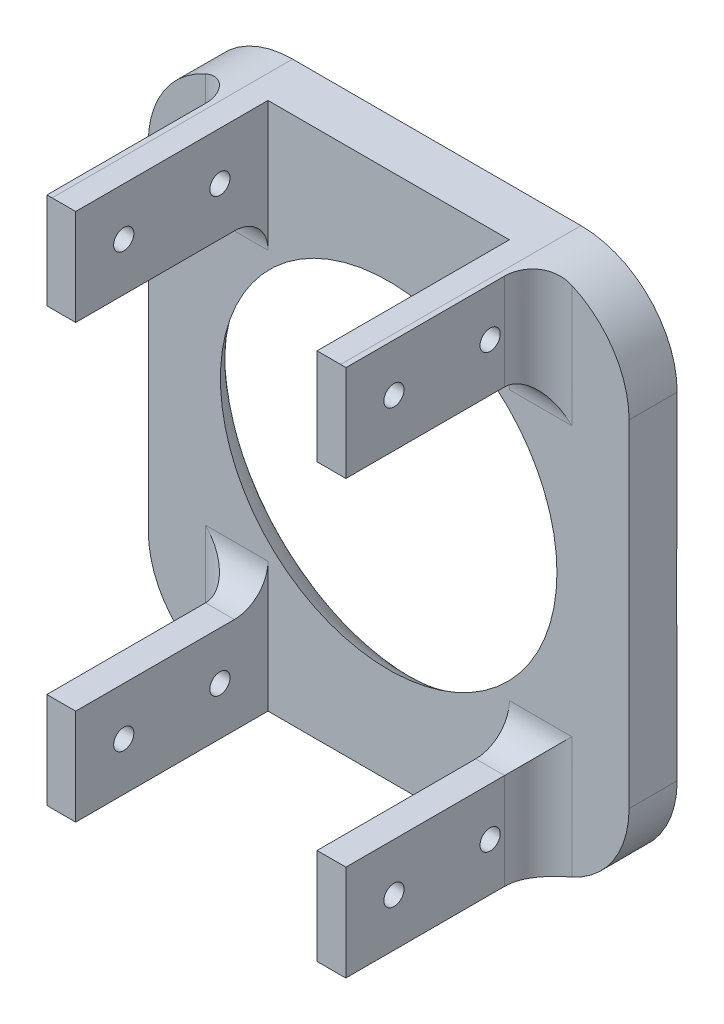
from build123d import *

# Parameters (mm, degrees)
SKETCH_1_W          = 100
SKETCH_1_H          = 110
SKETCH_1_R          = 35
EXTRUDE_1_DEPTH     = 10
SKETCH_2_W          = 6
SKETCH_2_H          = 20
EXTRUDE_2_DEPTH     = 40
FILLET_1_R          = 20
FILLET_2_R          = 7
SKETCH_3_R          = 2.1
CUT_EXTRUDE_1_DEPTH = 111.01004512
FILLET_3_R          = 20


with BuildPart() as part:
    # 草图1 → 凸台-拉伸1 (new body)
    with BuildSketch(Plane.XY):
        Rectangle(SKETCH_1_W, SKETCH_1_H)
        Circle(SKETCH_1_R, mode=Mode.SUBTRACT)
    extrude(amount=EXTRUDE_1_DEPTH)

    # 草图2 → 凸台-拉伸2 (add)
    with BuildSketch(Plane.XY.offset(10)):
        with Locations((-28.1, 45)):
            Rectangle(SKETCH_2_W, SKETCH_2_H)
        with Locations((28.1, 45)):
            Rectangle(SKETCH_2_W, SKETCH_2_H)
        with Locations((28.1, -45)):
            Rectangle(SKETCH_2_W, SKETCH_2_H)
        with Locations((-28.1, -45)):
            Rectangle(SKETCH_2_W, SKETCH_2_H)
    extrude(amount=EXTRUDE_2_DEPTH)

    # 圆角1
    # the kernel refuses this fillet: 20 mm, written as the material it takes off along each edge
    with BuildSketch(Plane(origin=(0, 0, 0), x_dir=(1, 0, 0), z_dir=(0, -1, 0))) as fillet_1_piece_1:
        with BuildLine():
            CenterArc((52.320508076, 20), FILLET_1_R, 210, 60)
            Line((35, 10), (35, 0))
            Line((35, 0), (52.320508076, 0))
        make_face()
    revolve(axis=Axis((0, 0, 0), (0, 0, 1)), mode=Mode.SUBTRACT)

    # 圆角2
    fillet_2_edges = [part.edges().sort_by_distance(p)[0] for p in [
        (-31.1, 45, 10),
        (-28.1, 35, 10),
        (28.1, 35, 10),
        (31.1, 45, 10),
        (31.1, -45, 10),
        (28.1, -35, 10),
        (-28.1, -35, 10),
        (-31.1, -45, 10),
    ]]
    fillet(fillet_2_edges, radius=FILLET_2_R)

    # 草图3 → 切除-拉伸1 (cut, through all)
    with BuildSketch(Plane.ZY.offset(31.1)):
        with Locations(Location((20, -45, 0), (0, 0, 270))):
            Circle(SKETCH_3_R)
        with Locations(Location((40, -45, 0), (0, 0, 270))):
            Circle(SKETCH_3_R)
        with Locations(Location((40, 45, 0), (0, 0, 270))):
            Circle(SKETCH_3_R)
        with Locations(Location((20, 45, 0), (0, 0, 270))):
            Circle(SKETCH_3_R)
    extrude(amount=-CUT_EXTRUDE_1_DEPTH, mode=Mode.SUBTRACT)

    # 圆角3
    fillet_3_edges = [part.edges().sort_by_distance(p)[0] for p in [
        (50, -55, 5),
        (50, 55, 5),
        (-50, 55, 5),
        (-50, -55, 5),
    ]]
    fillet(fillet_3_edges, radius=FILLET_3_R)


solid = part.part
